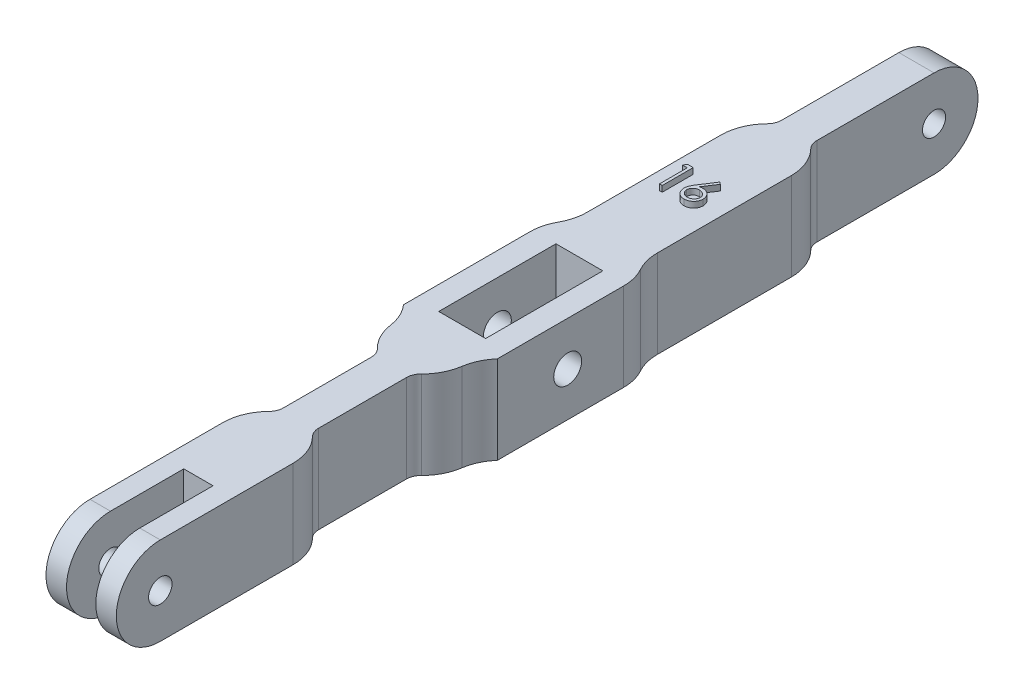
from build123d import *

# Parameters (mm, degrees)
SKETCH1_R           = 2
SKETCH1_R_2         = 2.38125
SKETCH1_R_3         = 1.97
BASE_DEPTH          = 6
ALL_CUTS_DEPTH      = 76.612498967
ALL_CUTS_DEPTH_BACK = 76.612498967
SKETCH2_W           = 5
SKETCH2_H           = 40
SKETCH2_W_2         = 6
SKETCH2_H_2         = 20
SKETCH2_H_3         = 30
SKETCH2_W_3         = 8
SKETCH3_W           = 16
SKETCH3_H           = 24
SKETCH3_W_2         = 8
SKETCH3_H_2         = 20
BOSS_EXTRUDE1_DEPTH = 15
SKETCH4_R           = 2.38125
CUT_EXTRUDE1_DEPTH  = 78.053552806
FILLET1_R           = 2.5
FILLET2_R           = 8
FILLET3_R           = 8
BOSS_EXTRUDE2_DEPTH = 1


with BuildPart() as part:
    # Sketch1 → BASE (new, symmetric)
    with BuildSketch(Plane(origin=(0, 0, 0), x_dir=(0, 0, -1), z_dir=(1, 0, 0))):
        with BuildLine():
            Line((-67.5, 7.5), (67.5, 7.5))
            ThreePointArc((67.5, 7.5), (75, 0), (67.5, -7.5))
            Line((67.5, -7.5), (-67.5, -7.5))
            ThreePointArc((-67.5, -7.5), (-75, 0), (-67.5, 7.5))
        make_face()
        with Locations((-67.5, 0)):
            Circle(SKETCH1_R, mode=Mode.SUBTRACT)
        Circle(SKETCH1_R_2, mode=Mode.SUBTRACT)
        with Locations((67.5, 0)):
            Circle(SKETCH1_R_3, mode=Mode.SUBTRACT)
    extrude(amount=BASE_DEPTH, both=True)

    # Sketch2 → All_Cuts (cut, two sides: drawn at the far end of the back side and taken through both)
    with BuildSketch(Plane(origin=(0, 0, 0), x_dir=(1, 0, 0), z_dir=(0, 1, 0)).offset(-ALL_CUTS_DEPTH_BACK)):
        with Locations((0, -75)):
            Rectangle(SKETCH2_W, SKETCH2_H)
        with Locations((-6, -30)):
            Rectangle(SKETCH2_W_2, SKETCH2_H_2)
        with Locations((6, -30)):
            Rectangle(SKETCH2_W_2, SKETCH2_H_2)
        with Locations((6, 60)):
            Rectangle(SKETCH2_W_2, SKETCH2_H_3)
        with Locations((-6, 60)):
            Rectangle(SKETCH2_W_2, SKETCH2_H_3)
        Rectangle(SKETCH2_W_3, SKETCH2_H_2)
    extrude(amount=ALL_CUTS_DEPTH + ALL_CUTS_DEPTH_BACK, mode=Mode.SUBTRACT)

    # Sketch3 → Boss-Extrude1 (add, through all)
    with BuildSketch(Plane.XZ.offset(7.5)):
        Rectangle(SKETCH3_W, SKETCH3_H)
        Rectangle(SKETCH3_W_2, SKETCH3_H_2, mode=Mode.SUBTRACT)
    extrude(amount=-BOSS_EXTRUDE1_DEPTH)

    # Sketch4 → Cut-Extrude1 (cut, through all)
    with BuildSketch(Plane.ZY.offset(8)):
        Circle(SKETCH4_R)
    extrude(amount=-CUT_EXTRUDE1_DEPTH, mode=Mode.SUBTRACT)

    # Fillet1
    fillet1_edges = [part.edges().sort_by_distance(p)[0] for p in [
        (3, 0, 20),
        (3, 0, 40),
        (-3, 0, 40),
        (-3, 0, 20),
        (3, 0, -45),
        (-3, 0, -45),
    ]]
    fillet(fillet1_edges, radius=FILLET1_R)

    # Fillet2
    # the kernel refuses this fillet: 8 mm, written as the material it adds along each edge
    with BuildSketch(Plane(origin=(-6, -7.5, -12), x_dir=(0, 0, -1), z_dir=(0, 1, 0))) as fillet2_piece_1:
        with BuildLine():
            CenterArc((5.291502622, 8), FILLET2_R, 228.590377891, 41.409622109)
            Line((0, 2), (-0.105830052, 1.88))
            ThreePointArc((-0.105830052, 1.88), (-0.16, 1), (-0.16, 0))
            Line((-0.16, 0), (0, -0.16))
            Line((0, -0.16), (5.291502622, -0.16))
            Line((5.291502622, -0.16), (5.291502622, 0))
        make_face()
    extrude(amount=15)
    with BuildSketch(Plane(origin=(6, -7.5, -12), x_dir=(1, 0, 0), z_dir=(0, 1, 0))) as fillet2_piece_2:
        with BuildLine():
            CenterArc((8, 5.291502622), FILLET2_R, 180, 41.409622109)
            Line((0, 5.291502622), (-0.16, 5.291502622))
            Line((-0.16, 5.291502622), (-0.16, 0))
            Line((-0.16, 0), (0, -0.16))
            ThreePointArc((0, -0.16), (1, -0.16), (1.88, -0.105830052))
            Line((1.88, -0.105830052), (2, 0))
        make_face()
    extrude(amount=15)
    with BuildSketch(Plane(origin=(6, 7.5, 12), x_dir=(0, 0, 1), z_dir=(0, -1, 0))) as fillet2_piece_3:
        with BuildLine():
            CenterArc((5.291502622, -8), FILLET2_R, 90, 41.409622109)
            Line((0, -2), (-0.105830052, -1.88))
            ThreePointArc((-0.105830052, -1.88), (-0.16, -1), (-0.16, 0))
            Line((-0.16, 0), (0, 0.16))
            Line((0, 0.16), (5.291502622, 0.16))
            Line((5.291502622, 0.16), (5.291502622, 0))
        make_face()
    extrude(amount=15)
    with BuildSketch(Plane(origin=(-6, 7.5, 12), x_dir=(-1, 0, 0), z_dir=(0, -1, 0))) as fillet2_piece_4:
        with BuildLine():
            CenterArc((8, -5.291502622), FILLET2_R, 138.590377891, 41.409622109)
            Line((0, -5.291502622), (-0.16, -5.291502622))
            Line((-0.16, -5.291502622), (-0.16, 0))
            Line((-0.16, 0), (0, 0.16))
            ThreePointArc((0, 0.16), (1, 0.16), (1.88, 0.105830052))
            Line((1.88, 0.105830052), (2, 0))
        make_face()
    extrude(amount=15)

    # Fillet3
    fillet3_edges = [part.edges().sort_by_distance(p)[0] for p in [
        (8, 0, -12),
        (-8, 0, -12),
        (-6, 0, 20),
        (6, 0, 20),
        (-6, 0, -45),
        (6, 0, -45),
        (6, 0, 40),
        (-6, 0, 40),
    ]]
    fillet(fillet3_edges, radius=FILLET3_R)

    # Sketch5 → Boss-Extrude2 (add)
    # profile 1 of 2: a face of its own
    with BuildSketch(Plane(origin=(0, 7.5, 0), x_dir=(1, 0, 0), z_dir=(0, 1, 0))):
        Polygon((-3.52782764, 31.96394622), (-2.549420522, 31.96394622), (-2.549420522, 26.672279553), (-3.024313685, 26.672279553), (-3.024313685, 31.421211177), (-3.838416249, 31.421211177), align=None)
    # profile 2 of 2: a face of its own
    with BuildSketch(Plane(origin=(0, 7.5, 0), x_dir=(1, 0, 0), z_dir=(0, 1, 0))):
        with BuildLine():
            Line((1.8603017, 32.09962998), (2.226011836, 31.812362018))
            Line((2.226011836, 31.812362018), (0.827833083, 29.674282758))
            add(Edge.make_bspline(
                [(0.827833083, 29.674282758), (0.920921478, 29.689120381), (1.102500918, 29.718062841), (1.286296979, 29.722837354), (1.375868273, 29.725164168)],
                knots=[0, 0, 0, 0, 1.025318673, 2, 2, 2, 2], degree=3))
            add(Edge.make_bspline(
                [(1.375868273, 29.725164168), (1.4296505, 29.723718619), (1.535519212, 29.720873097), (1.690953306, 29.698974894), (1.840312769, 29.664465498), (1.98297854, 29.614161016), (2.119462691, 29.549901504), (2.250548456, 29.472886784), (2.373771734, 29.3791401), (2.49071935, 29.274418084), (2.596896033, 29.15842931), (2.690900307, 29.035358241), (2.769862242, 28.9053331), (2.833927576, 28.768419743), (2.883676619, 28.624829219), (2.919943654, 28.474745247), (2.941381848, 28.318064331), (2.944293006, 28.211508043), (2.945771785, 28.157380715)],
                knots=[0, 0, 0, 0, 1.04369286, 2.054478336, 3.041073146, 4.015093852, 4.984733326, 5.965804835, 6.960378782, 7.985147595, 9.009457201, 10.008161701, 10.986880575, 11.956520048, 12.937015923, 13.931873656, 14.949455224, 16, 16, 16, 16], degree=3))
            add(Edge.make_bspline(
                [(2.945771785, 28.157380715), (2.943620186, 28.083328067), (2.939386349, 27.937609982), (2.897198467, 27.725373771), (2.831642813, 27.523182944), (2.737938693, 27.334265649), (2.621548661, 27.158880812), (2.479614682, 27.003478977), (2.31717036, 26.864882611), (2.133493892, 26.748985104), (1.935822982, 26.654335253), (1.728159843, 26.586352089), (1.512521181, 26.54449732), (1.366161833, 26.539250099), (1.292125952, 26.536595792)],
                knots=[0, 0, 0, 0, 1.031375318, 2.029502543, 3.004789286, 3.987476834, 4.960371455, 5.9300674, 6.912260825, 7.929083631, 8.949397511, 9.960523116, 10.96833055, 12, 12, 12, 12], degree=3))
            add(Edge.make_bspline(
                [(1.292125952, 26.536595792), (1.220920226, 26.538906294), (1.07987415, 26.543482993), (0.872391235, 26.584252923), (0.673026911, 26.6503339), (0.483177966, 26.741372154), (0.307312278, 26.856364429), (0.149974946, 26.994797875), (0.011950478, 27.153713376), (-0.102915914, 27.333086282), (-0.194021377, 27.525838956), (-0.26234424, 27.726827276), (-0.302252846, 27.935318915), (-0.307829593, 28.076653494), (-0.310638471, 28.14784045)],
                knots=[0, 0, 0, 0, 1.012016664, 2.004627821, 2.994792927, 3.992885782, 4.990978636, 5.973936114, 6.964471063, 7.975201453, 8.993600317, 9.990122807, 10.98767138, 12, 12, 12, 12], degree=3))
            add(Edge.make_bspline(
                [(-0.310638471, 28.14784045), (-0.308852239, 28.202336427), (-0.305205094, 28.3136068), (-0.279739491, 28.482129795), (-0.238820099, 28.654564168), (-0.192993894, 28.800847294), (-0.144574221, 28.920683167), (-0.10427812, 29.017299159), (-0.054122197, 29.116723638), (-0.000641014, 29.222365921), (0.060979491, 29.331503421), (0.127980532, 29.445960159), (0.202214528, 29.563915835), (0.254254536, 29.643962416), (0.280857923, 29.684883052)],
                knots=[0, 0, 0, 0, 1.173818275, 2.396712641, 3.66331629, 4.989737886, 5.693666774, 6.447286557, 7.243889047, 8.091586357, 8.998013824, 9.943181721, 10.948533338, 12, 12, 12, 12], degree=3))
            Line((0.280857923, 29.684883052), (1.8603017, 32.09962998))
        make_face()
        with BuildLine():
            add(Edge.make_bspline(
                [(1.276225511, 29.182429126), (1.235914736, 29.181252798), (1.157176083, 29.178955087), (1.041655349, 29.165612147), (0.9323246, 29.140485703), (0.827735362, 29.108484225), (0.729843001, 29.06448317), (0.637936065, 29.011034617), (0.551659141, 28.948107359), (0.471915914, 28.876592887), (0.399617138, 28.798294313), (0.33735519, 28.714429678), (0.283648704, 28.627020109), (0.239982145, 28.535335268), (0.205979292, 28.439410203), (0.181383246, 28.3396861), (0.167694836, 28.235494232), (0.165417558, 28.164839139), (0.164254691, 28.128759922)],
                knots=[0, 0, 0, 0, 1.129588631, 2.206414736, 3.251139165, 4.268635594, 5.265702196, 6.250456724, 7.242448911, 8.251968645, 9.246821453, 10.222880186, 11.173611482, 12.116736599, 13.062300278, 14.020270554, 14.989073742, 16, 16, 16, 16], degree=3))
            add(Edge.make_bspline(
                [(0.164254691, 28.128759922), (0.16520169, 28.093003404), (0.167058614, 28.022890197), (0.18391986, 27.919567866), (0.209675282, 27.820137588), (0.247987547, 27.725111957), (0.293687723, 27.633042523), (0.354020773, 27.547264175), (0.420872342, 27.462567164), (0.500782455, 27.385457797), (0.586542778, 27.313707901), (0.678166025, 27.250993708), (0.773657869, 27.197341993), (0.874307519, 27.155294262), (0.97868698, 27.120786114), (1.087665913, 27.096502688), (1.201320111, 27.082773797), (1.278309232, 27.080493552), (1.317566657, 27.079330835)],
                knots=[0, 0, 0, 0, 0.989467248, 1.94019797, 2.891935182, 3.827694429, 4.772920941, 5.730924762, 6.725747692, 7.756678648, 8.79901574, 9.819492441, 10.826891316, 11.826466727, 12.835195252, 13.867842842, 14.912794438, 16, 16, 16, 16], degree=3))
            add(Edge.make_bspline(
                [(1.317566657, 27.079330835), (1.356824018, 27.080493643), (1.433813013, 27.082774067), (1.547468125, 27.096501662), (1.656443678, 27.120789879), (1.760835423, 27.155280615), (1.86143973, 27.19739262), (1.956848059, 27.250659927), (2.047604819, 27.314093582), (2.13342144, 27.385335181), (2.212998942, 27.463006041), (2.281453876, 27.546508121), (2.33993924, 27.633735796), (2.387464737, 27.724749273), (2.425355023, 27.820195046), (2.451241051, 27.919552474), (2.468067476, 28.022894227), (2.469929184, 28.093004765), (2.470878623, 28.128759922)],
                knots=[0, 0, 0, 0, 1.087397944, 2.132534446, 3.165364764, 4.174271784, 5.174024072, 6.181601208, 7.194203697, 8.236725232, 9.267838612, 10.269026844, 11.221737037, 12.171628256, 13.107553087, 14.05945871, 15.010357665, 16, 16, 16, 16], degree=3))
            add(Edge.make_bspline(
                [(2.470878623, 28.128759922), (2.470046632, 28.164886207), (2.468413705, 28.235790356), (2.449944355, 28.339639493), (2.424329099, 28.439916888), (2.385649993, 28.535992311), (2.335399503, 28.62748663), (2.274192447, 28.714862026), (2.203386061, 28.798788385), (2.121595733, 28.87674644), (2.032559308, 28.948028332), (1.937890506, 29.010953137), (1.838848689, 29.064058757), (1.735534276, 29.108368304), (1.626763489, 29.140344295), (1.514292381, 29.165522413), (1.396682455, 29.178920939), (1.316889249, 29.181244836), (1.276225511, 29.182429126)],
                knots=[0, 0, 0, 0, 0.978206639, 1.919901502, 2.851605144, 3.780102724, 4.718870031, 5.675451981, 6.667674623, 7.690630536, 8.733308323, 9.756129687, 10.767539656, 11.776269907, 12.797430371, 13.836405707, 14.897401972, 16, 16, 16, 16], degree=3))
        make_face(mode=Mode.SUBTRACT)
    extrude(amount=BOSS_EXTRUDE2_DEPTH)


solid = part.part
